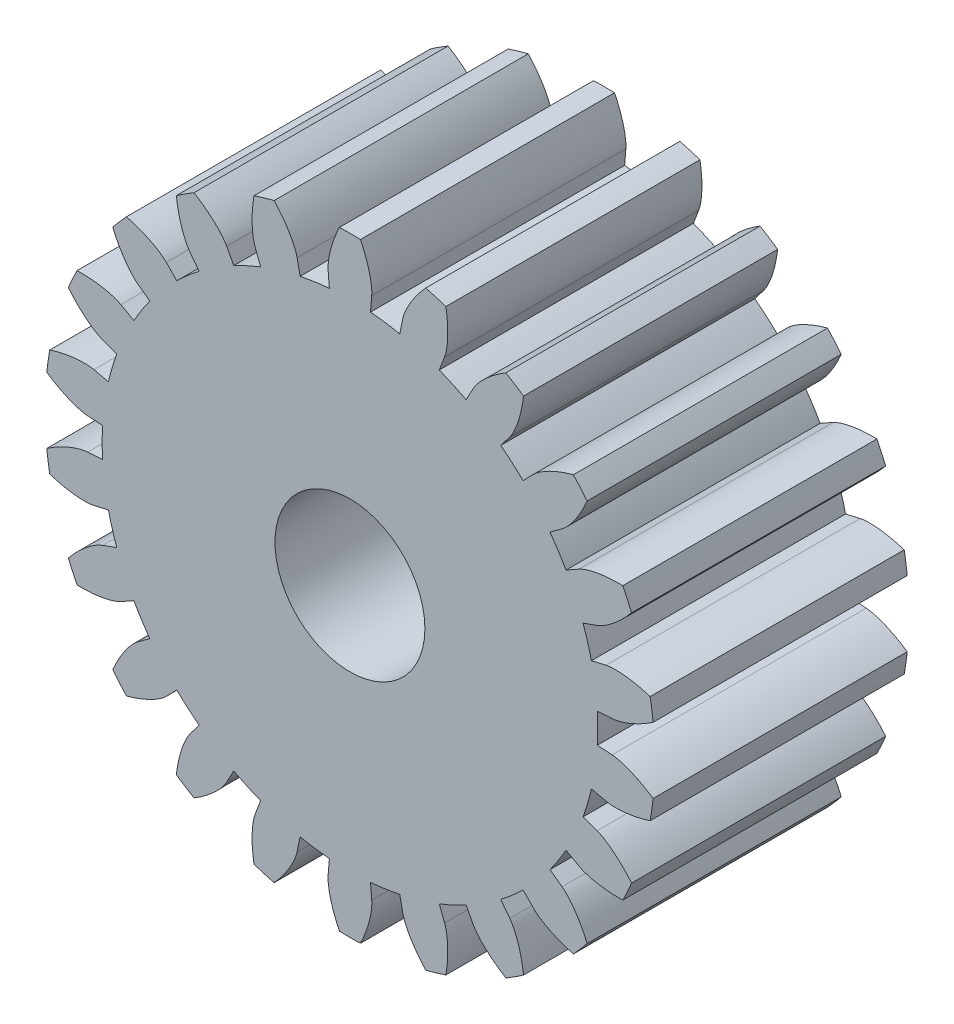
from build123d import *

# Parameters (mm, degrees)
SKETCH_1_R               = 6
SKETCH_1_R_2             = 1.475
EXTRUDE_1_DEPTH          = 5
CUT_EXTRUDE_1_DEPTH      = 10.848857802
PATTERN_CIRCULAR_1_COUNT = 22
PATTERN_CIRCULAR_1_ANGLE = 343.636363636


with BuildPart() as part:
    # 草图1 → 凸台-拉伸1 (new body)
    with BuildSketch(Plane.XY):
        Circle(SKETCH_1_R)
        Circle(SKETCH_1_R_2, mode=Mode.SUBTRACT)
    extrude(amount=EXTRUDE_1_DEPTH)

    # 草图1<3> → 切除-拉伸1 (cut, through all)
    with BuildSketch(Plane.XY):
        with BuildLine():
            Line((5.159091573, 0.30853905), (4.866305285, 0.29102899))
            ThreePointArc((4.866305285, 0.29102899), (4.872825836, 0.145579421), (4.875, 0))
            ThreePointArc((4.875, 0), (4.872825836, -0.145579421), (4.866305285, -0.29102899))
            Line((4.866305285, -0.29102899), (5.159091573, -0.30853905))
            add(Edge.make_bspline(
                [(5.159091573, -0.30853905), (5.178733957, -0.309713761), (5.217802138, -0.313899942), (5.32617204, -0.335241934), (5.526566373, -0.400309241), (5.708399914, -0.48800664), (5.864179572, -0.58141045), (5.956030492, -0.642829285), (5.964821916, -0.648767682)],
                knots=[0, 0, 0, 0, 0, 0.002802034, 0.005604068, 0.015718248, 0.029959916, 0.031472599, 0.031472599, 0.031472599, 0.031472599, 0.031472599], degree=4))
            ThreePointArc((5.964821916, -0.648767682), (5.991199024, -0.324860355), (6, 0))
            ThreePointArc((6, 0), (5.991199024, 0.324860355), (5.964821916, 0.648767682))
            add(Edge.make_bspline(
                [(5.159091573, 0.30853905), (5.178733957, 0.309713761), (5.217802138, 0.313899942), (5.32617204, 0.335241934), (5.526566373, 0.400309241), (5.708399914, 0.48800664), (5.864179572, 0.58141045), (5.956030492, 0.642829285), (5.964821916, 0.648767682)],
                knots=[0, 0, 0, 0, 0, 0.002802034, 0.005604068, 0.015718248, 0.029959916, 0.031472599, 0.031472599, 0.031472599, 0.031472599, 0.031472599], degree=4))
        make_face()
    cut_extrude_1 = extrude(amount=CUT_EXTRUDE_1_DEPTH, mode=Mode.SUBTRACT)

    # 阵列(圆周)1: 切除-拉伸1 ×22 about axis
    pattern_circular_1_axis = Axis((0, 0, 5), (0, 0, 1))
    for i in range(1, PATTERN_CIRCULAR_1_COUNT):
        add(cut_extrude_1.rotate(pattern_circular_1_axis, i * PATTERN_CIRCULAR_1_ANGLE / (PATTERN_CIRCULAR_1_COUNT - 1)), mode=Mode.SUBTRACT)


solid = part.part
